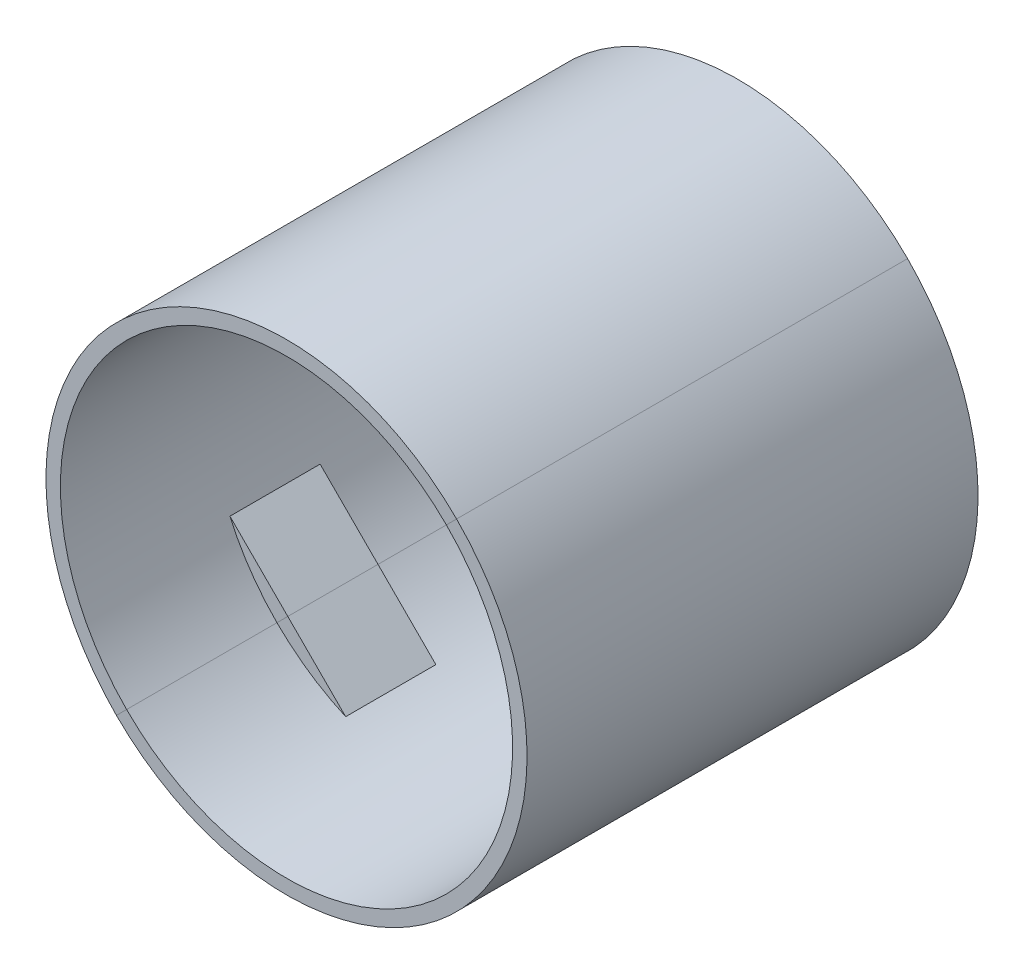
from build123d import *

# Parameters (mm, degrees)
SKETCH_1_R          = 80
EXTRUDE_1_DEPTH     = 150
CUT_EXTRUDE_1_DEPTH = 10
SKETCH_4_R          = 75.2
CUT_EXTRUDE_2_DEPTH = 120
EXTRUDE_START       = -50
EXTRUDE_2_DEPTH     = 30
CUT_EXTRUDE_START   = -30
CUT_EXTRUDE_3_DEPTH = 30
FILLET_1_R          = 10


# Read off the part's stored shape, not the designer's step: 交差1
with BuildPart() as part:
    # ｽｹｯﾁ1 → ﾎﾞｽ - 押し出し1 (new body)
    with BuildSketch(Plane.XY):
        Circle(SKETCH_1_R)
    extrude(amount=EXTRUDE_1_DEPTH)

    # ｽｹｯﾁ2 → ｶｯﾄ - 押し出し1 (cut)
    with BuildSketch(Plane(origin=(0, 0, 0), x_dir=(-1, 0, 0), z_dir=(0, 0, -1))):
        Polygon((-68.8, 0), (-68.15, -1.125833025), (-66.85, -1.125833025), (-66.2, 0), (-66.85, 1.125833025), (-68.15, 1.125833025), align=None)
        Polygon((0, -68.8), (1.125833025, -68.15), (1.125833025, -66.85), (0, -66.2), (-1.125833025, -66.85), (-1.125833025, -68.15), align=None)
        Polygon((0, 68.8), (-1.125833025, 68.15), (-1.125833025, 66.85), (0, 66.2), (1.125833025, 66.85), (1.125833025, 68.15), align=None)
        Polygon((68.8, 0), (68.15, 1.125833025), (66.85, 1.125833025), (66.2, 0), (66.85, -1.125833025), (68.15, -1.125833025), align=None)
    extrude(amount=-CUT_EXTRUDE_1_DEPTH, mode=Mode.SUBTRACT)

    # ｽｹｯﾁ4 → ｶｯﾄ - 押し出し2 (cut)
    with BuildSketch(Plane.XY.offset(150)):
        Circle(SKETCH_4_R)
    extrude(amount=-CUT_EXTRUDE_2_DEPTH, mode=Mode.SUBTRACT)

    # ｽｹｯﾁ5 → ﾎﾞｽ - 押し出し2 (add)
    with BuildSketch(Plane.XY.offset(150).offset(EXTRUDE_START)):
        with BuildLine():
            Line((68.816951555, -30.319419167), (30.319419167, -68.816951555))
            ThreePointArc((30.319419167, -68.816951555), (53.174429945, -53.174429945), (68.816951555, -30.319419167))
        make_face()
        with BuildLine():
            ThreePointArc((68.816951555, 30.319419167), (53.174429945, 53.174429945), (30.319419167, 68.816951555))
            Line((30.319419167, 68.816951555), (68.816951555, 30.319419167))
        make_face()
        with BuildLine():
            Line((-30.319419167, -68.816951555), (-68.816951555, -30.319419167))
            ThreePointArc((-68.816951555, -30.319419167), (-53.174429945, -53.174429945), (-30.319419167, -68.816951555))
        make_face()
        with BuildLine():
            ThreePointArc((-30.319419167, 68.816951555), (-53.174429945, 53.174429945), (-68.816951555, 30.319419167))
            Line((-68.816951555, 30.319419167), (-30.319419167, 68.816951555))
        make_face()
    extrude(amount=-EXTRUDE_2_DEPTH)

    # ｽｹｯﾁ6 → ｶｯﾄ - 押し出し3 (cut)
    with BuildSketch(Plane(origin=(0, 0, 0), x_dir=(-1, 0, 0), z_dir=(0, 0, -1)).offset(CUT_EXTRUDE_START)):
        with BuildLine():
            Line((7.5, -69.64766161), (7.5, -74.825062646))
            ThreePointArc((7.5, -74.825062646), (53.174429945, -53.174429945), (74.825062646, -7.5))
            Line((74.825062646, -7.5), (69.64766161, -7.5))
            ThreePointArc((69.64766161, -7.5), (62.14766161, 0), (69.64766161, 7.5))
            Line((69.64766161, 7.5), (74.825062646, 7.5))
            ThreePointArc((74.825062646, 7.5), (53.174429945, 53.174429945), (7.5, 74.825062646))
            Line((7.5, 74.825062646), (7.5, 69.64766161))
            ThreePointArc((7.5, 69.64766161), (0, 62.14766161), (-7.5, 69.64766161))
            Line((-7.5, 69.64766161), (-7.5, 74.825062646))
            ThreePointArc((-7.5, 74.825062646), (-53.174429945, 53.174429945), (-74.825062646, 7.5))
            Line((-74.825062646, 7.5), (-69.64766161, 7.5))
            ThreePointArc((-69.64766161, 7.5), (-62.14766161, 0), (-69.64766161, -7.5))
            Line((-69.64766161, -7.5), (-74.825062646, -7.5))
            ThreePointArc((-74.825062646, -7.5), (-53.174429945, -53.174429945), (-7.5, -74.825062646))
            Line((-7.5, -74.825062646), (-7.5, -69.64766161))
            ThreePointArc((-7.5, -69.64766161), (0, -62.14766161), (7.5, -69.64766161))
        make_face()
    extrude(amount=CUT_EXTRUDE_3_DEPTH, mode=Mode.SUBTRACT)

    # ﾌｨﾚｯﾄ1
    # the kernel refuses this fillet: 10 mm, written as the material it adds along each edge
    with BuildSketch(Plane(origin=(-7.5, -74.825062646, 30), x_dir=(0.06730051941695048, 0.9977327498314409, 0), z_dir=(0, 0, -1)), Plane(origin=(74.825062646, -7.5, 30), x_dir=(-0.9977327498314487, 0.06730051941683622, 0), z_dir=(0, 0, -1))) as fillet_1_piece_1:
        with BuildLine():
            CenterArc((11.066494574, -9.51273846), FILLET_1_R, 107.959660536, 82.610248426)
            Line((1.236176348, -11.347089457), (0.253144526, -11.530524557))
            ThreePointArc((0.253144526, -11.530524557), (-0.591630476, -5.805334082), (-0.999470338, -0.032542953))
            Line((-0.999470338, -0.032542953), (0.067300519, 0.99773275))
            ThreePointArc((0.067300519, 0.99773275), (5.232963092, 0.649290971), (7.67467405, 0.951273846))
            Line((7.67467405, 0.951273846), (7.983021371, 0))
        make_face()
    extrude(amount=30)
    with BuildSketch(Plane(origin=(7.5, -74.825062646, 30), x_dir=(-0.0673005194169865, 0.9977327498314384, 0), z_dir=(0, 0, -1)), Plane(origin=(74.825062646, 7.5, 30), x_dir=(-0.9977327498314484, -0.06730051941683877, 0), z_dir=(0, 0, -1)), Plane(origin=(-7.5, 74.825062646, 30), x_dir=(0.06730051941695114, -0.9977327498314409, 0), z_dir=(0, 0, -1)), Plane(origin=(-74.825062646, -7.5, 30), x_dir=(0.9977327498314408, 0.06730051941695224, 0), z_dir=(0, 0, -1))) as fillet_1_piece_2:
        with BuildLine():
            CenterArc((11.066494574, 9.51273846), FILLET_1_R, 169.430091038, 82.610248426)
            Line((1.236176348, 11.347089457), (0.253144526, 11.530524557))
            ThreePointArc((0.253144526, 11.530524557), (-0.591630476, 5.805334082), (-0.999470338, 0.032542953))
            Line((-0.999470338, 0.032542953), (0.067300519, -0.99773275))
            ThreePointArc((0.067300519, -0.99773275), (5.232963092, -0.649290971), (7.67467405, -0.951273846))
            Line((7.67467405, -0.951273846), (7.983021371, 0))
        make_face()
    extrude(amount=30)
    with BuildSketch(Plane(origin=(7.5, 74.825062646, 30), x_dir=(0.9845754560229286, -0.17496048524521768, 0), z_dir=(0, 0, -1)), Plane(origin=(-74.825062646, 7.5, 30), x_dir=(0.17496048524522154, 0.9845754560229281, 0), z_dir=(0, 0, -1))) as fillet_1_piece_3:
        with BuildLine():
            CenterArc((10.65530205, 9.971160082), FILLET_1_R, 191.7422545, 82.610248426)
            Line((0.864572123, 7.936066107), (-0.11450087, 7.732556709))
            ThreePointArc((-0.11450087, 7.732556709), (-0.078734858, 5.272502471), (-0.984575456, 0.174960485))
            Line((-0.984575456, 0.174960485), (-0.075892465, -0.997116008))
            ThreePointArc((-0.075892465, -0.997116008), (5.707113349, -1.216876184), (11.490119163, -0.997116008))
            Line((11.490119163, -0.997116008), (11.414226698, 0))
        make_face()
    extrude(amount=30)


with BuildPart() as body_2:
    # 交差1: the piece on the far side of the plane
    add(part.part)
    split(bisect_by=Plane(origin=(0, 0, 0), x_dir=(0.707106781186548, 0.707106781186547, 0), z_dir=(0.707106781186547, -0.707106781186548, 0)), keep=Keep.BOTTOM)


with BuildPart() as part_1:
    add(part.part)

    # 交差1
    split(bisect_by=Plane(origin=(0, 0, 0), x_dir=(0.707106781186548, 0.707106781186547, 0), z_dir=(0.707106781186547, -0.707106781186548, 0)), keep=Keep.TOP)


solid = Compound([body_2.part, part_1.part])
